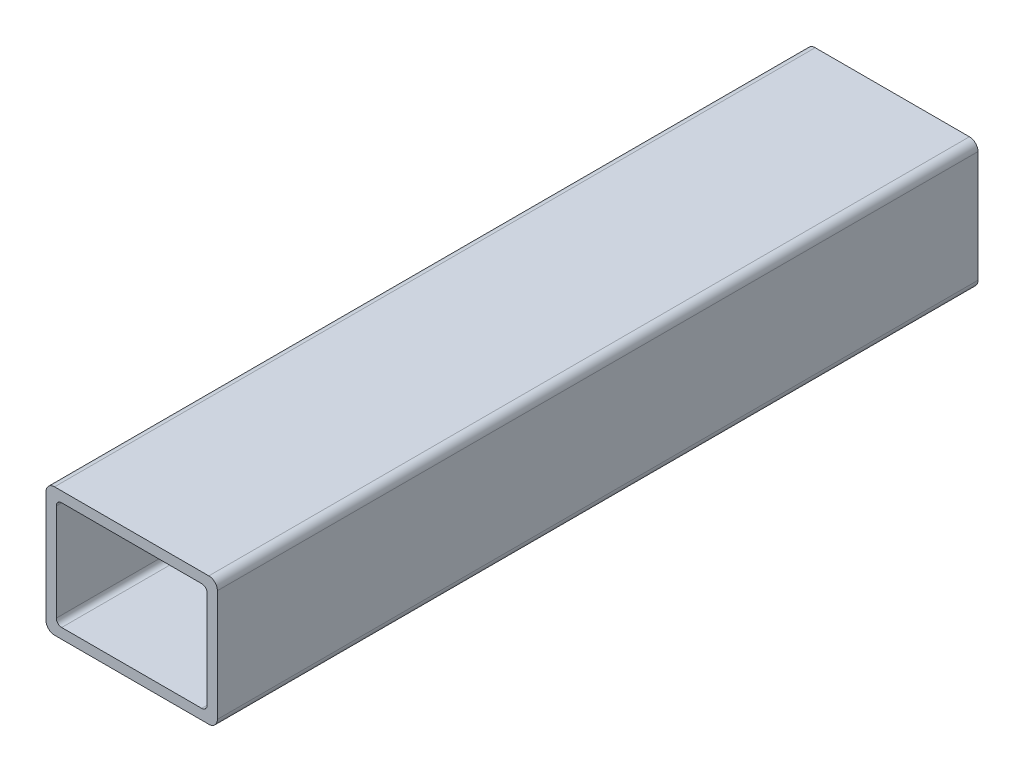
from build123d import *

# Parameters (mm, degrees)
BOSS_EXTRUDE1_DEPTH = 225.425


with BuildPart() as part:
    # Sketch4 → Boss-Extrude1 (new body)
    with BuildSketch(Plane.XY):
        with BuildLine():
            Line((25.4, -16.51), (25.4, 16.51))
            ThreePointArc((25.4, 16.51), (24.656051224, 18.306051224), (22.86, 19.05))
            Line((22.86, 19.05), (-22.86, 19.05))
            ThreePointArc((-22.86, 19.05), (-24.656051224, 18.306051224), (-25.4, 16.51))
            Line((-25.4, 16.51), (-25.4, -16.51))
            ThreePointArc((-25.4, -16.51), (-24.656051224, -18.306051224), (-22.86, -19.05))
            Line((-22.86, -19.05), (22.86, -19.05))
            ThreePointArc((22.86, -19.05), (24.656051224, -18.306051224), (25.4, -16.51))
        make_face()
        with BuildLine():
            Line((22.352, 14.4018), (22.352, -14.4018))
            ThreePointArc((22.352, -14.4018), (21.883312271, -15.533312271), (20.7518, -16.002))
            Line((20.7518, -16.002), (-20.7518, -16.002))
            ThreePointArc((-20.7518, -16.002), (-21.883312271, -15.533312271), (-22.352, -14.4018))
            Line((-22.352, -14.4018), (-22.352, 14.4018))
            ThreePointArc((-22.352, 14.4018), (-21.883312271, 15.533312271), (-20.7518, 16.002))
            Line((-20.7518, 16.002), (20.7518, 16.002))
            ThreePointArc((20.7518, 16.002), (21.883312271, 15.533312271), (22.352, 14.4018))
        make_face(mode=Mode.SUBTRACT)
    extrude(amount=BOSS_EXTRUDE1_DEPTH)


solid = part.part
